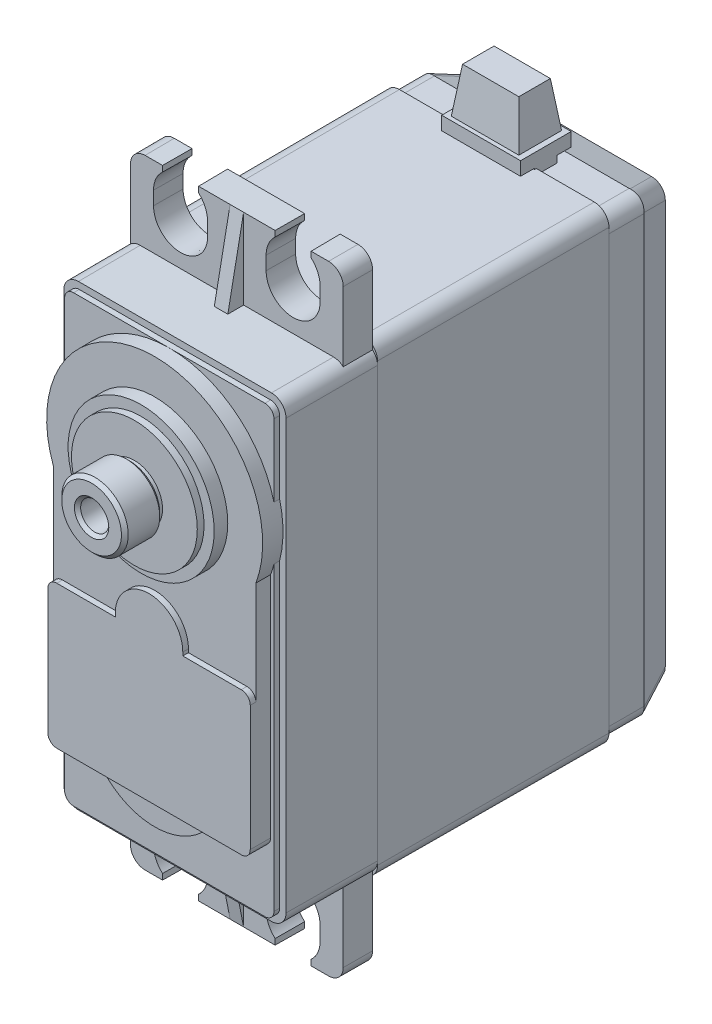
from build123d import *
from OCP.BRepFilletAPI import BRepFilletAPI_MakeChamfer

# Parameters (mm, degrees)
SKETCH1_W                       = 19.8
SKETCH1_H                       = 41.4
BOSS_EXTRUDE1_DEPTH             = 20.5
BOSS_EXTRUDE1_DRAFT             = 0.15
SKETCH2_W                       = 19.9
SKETCH2_H                       = 40.5
BOSS_EXTRUDE2_DEPTH             = 6.1
SKETCH4_W                       = 19.8
SKETCH4_H                       = 55
BOSS_EXTRUDE3_DEPTH             = 2.6
BOSS_EXTRUDE3_TAPER             = 0.2
SKETCH6_W                       = 19.781848502
SKETCH6_H                       = 40.7
BOSS_EXTRUDE4_DEPTH             = 6
BOSS_EXTRUDE4_TAPER             = 0.2
SKETCH19_W                      = 2
SKETCH19_H                      = 9
CUT_EXTRUDE4_DEPTH              = 2.6
CUT_EXTRUDE4_DRAFT              = -0.2
CUT_EXTRUDE4_PROFILE_2_DEPTH    = 2.6
CUT_EXTRUDE4_PROFILE_2_DRAFT    = -0.2
CUT_EXTRUDE4_PROFILE_3_DEPTH    = 2.6
CUT_EXTRUDE4_PROFILE_3_DRAFT    = -0.2
CUT_EXTRUDE4_PROFILE_4_DEPTH    = 2.6
CUT_EXTRUDE4_PROFILE_4_DRAFT    = -0.2
SKETCH8_OUTSIDE_W               = 35.562
SKETCH8_OUTSIDE_H               = 70.654
SKETCH8_OUTSIDE_W_2             = 18.6
SKETCH8_OUTSIDE_H_2             = 39.5
CUT_EXTRUDE1_DEPTH              = 0.5
BOSS_EXTRUDE5_DEPTH             = 1.8
CHAMFER1_SIZE                   = 0.3
DRAFT1_ANGLE                    = 0.2
CUT_EXTRUDE2_DEPTH              = 42.327539565
CUT_EXTRUDE2_DRAFT              = -0.5
CUT_EXTRUDE2_PROFILE_2_DEPTH    = 42.327539565
CUT_EXTRUDE2_PROFILE_2_DRAFT    = -0.5
CUT_EXTRUDE2_PROFILE_3_DEPTH    = 42.327539565
CUT_EXTRUDE2_PROFILE_3_DRAFT    = -0.5
CUT_EXTRUDE2_PROFILE_4_DEPTH    = 42.327539565
CUT_EXTRUDE2_PROFILE_4_DRAFT    = -0.5
BOSS_EXTRUDE6_DEPTH             = 3.5
CUT_EXTRUDE3_DEPTH              = 40.533347019
BOSS_EXTRUDE7_DEPTH             = 0.6
BOSS_EXTRUDE8_DEPTH             = 0.5
BOSS_EXTRUDE8_TAPER             = 0.2
CHAMFER2_SIZE                   = 3
CHAMFER2_SIZE2                  = 1.091910703
FILLET1_R                       = 1.3
FILLET2_R                       = 1.3
FILLET3_R                       = 0.8
M3X0_5_TAPPED_HOLE1_D           = 2.5
M3X0_5_TAPPED_HOLE1_DEPTH       = 6.5
M3X0_5_TAPPED_HOLE1_CSINK_D     = 3.05
M3X0_5_TAPPED_HOLE1_CSINK_ANGLE = 90
M3X0_5_TAPPED_HOLE1_TIP         = 0.751075774


with BuildPart() as part:
    # Sketch1 → Boss-Extrude1 (with draft: the straight prism first)
    with BuildSketch(Plane.XY):
        Rectangle(SKETCH1_W, SKETCH1_H)
    extrude(amount=-BOSS_EXTRUDE1_DEPTH)
    # Boss-Extrude1: the draft: its side faces are tilted about the plane it starts from
    boss_extrude1_sides = [part.faces().sort_by_distance(p)[0] for p in [
        (0, -20.7, -10.25),
        (9.9, 0, -10.25),
        (0, 20.7, -10.25),
        (-9.9, 0, -10.25),
    ]]
    draft(boss_extrude1_sides, Plane.XY, BOSS_EXTRUDE1_DRAFT)

    # Sketch2 → Boss-Extrude2 (add)
    with BuildSketch(Plane(origin=(0, 0, -20.5), x_dir=(-1, 0, 0), z_dir=(0, 0, -1))):
        Rectangle(SKETCH2_W, SKETCH2_H)
    extrude(amount=BOSS_EXTRUDE2_DEPTH)

    # Sketch4 → Boss-Extrude3 (add)
    with BuildSketch(Plane.XY):
        Rectangle(SKETCH4_W, SKETCH4_H)
    extrude(amount=BOSS_EXTRUDE3_DEPTH, taper=BOSS_EXTRUDE3_TAPER)

    # Sketch6 → Boss-Extrude4 (add)
    with BuildSketch(Plane.XY.offset(2.6)):
        Rectangle(SKETCH6_W, SKETCH6_H)
    extrude(amount=BOSS_EXTRUDE4_DEPTH, taper=BOSS_EXTRUDE4_TAPER)


with BuildPart() as cut_extrude4_tool:
    # Sketch19 → Cut-Extrude4 (with draft: the straight prism first)
    with BuildSketch(Plane.XY.offset(2.6)):
        with Locations((-10.45, 24.85)):
            Rectangle(SKETCH19_W, SKETCH19_H)
    extrude(amount=-CUT_EXTRUDE4_DEPTH)
    # Cut-Extrude4: the draft: its side faces are tilted about the plane it starts from
    cut_extrude4_sides = [cut_extrude4_tool.faces().sort_by_distance(p)[0] for p in [
        (-9.45, 24.85, 1.3),
        (-10.45, 29.35, 1.3),
        (-11.45, 24.85, 1.3),
        (-10.45, 20.35, 1.3),
    ]]
    draft(cut_extrude4_sides, Plane.XY.offset(2.6), CUT_EXTRUDE4_DRAFT)


with BuildPart() as part_1:
    add(part.part)

    # Cut-Extrude4: cut by cut_extrude4_tool
    add(cut_extrude4_tool.part, mode=Mode.SUBTRACT)


with BuildPart() as cut_extrude4_profile_2_tool:
    # Sketch19 → Cut-Extrude4 profile 2 (with draft: the straight prism first)
    with BuildSketch(Plane.XY.offset(2.6)):
        with Locations((10.45, 24.85)):
            Rectangle(SKETCH19_W, SKETCH19_H)
    extrude(amount=-CUT_EXTRUDE4_PROFILE_2_DEPTH)
    # Cut-Extrude4 profile 2: the draft: its side faces are tilted about the plane it starts from
    cut_extrude4_profile_2_sides = [cut_extrude4_profile_2_tool.faces().sort_by_distance(p)[0] for p in [
        (11.45, 24.85, 1.3),
        (10.45, 29.35, 1.3),
        (9.45, 24.85, 1.3),
        (10.45, 20.35, 1.3),
    ]]
    draft(cut_extrude4_profile_2_sides, Plane.XY.offset(2.6), CUT_EXTRUDE4_PROFILE_2_DRAFT)


with BuildPart() as part_2:
    add(part_1.part)

    # Cut-Extrude4 profile 2: cut by cut_extrude4_profile_2_tool
    add(cut_extrude4_profile_2_tool.part, mode=Mode.SUBTRACT)


with BuildPart() as cut_extrude4_profile_3_tool:
    # Sketch19 → Cut-Extrude4 profile 3 (with draft: the straight prism first)
    with BuildSketch(Plane.XY.offset(2.6)):
        with Locations((10.45, -24.85)):
            Rectangle(SKETCH19_W, SKETCH19_H)
    extrude(amount=-CUT_EXTRUDE4_PROFILE_3_DEPTH)
    # Cut-Extrude4 profile 3: the draft: its side faces are tilted about the plane it starts from
    cut_extrude4_profile_3_sides = [cut_extrude4_profile_3_tool.faces().sort_by_distance(p)[0] for p in [
        (9.45, -24.85, 1.3),
        (10.45, -29.35, 1.3),
        (11.45, -24.85, 1.3),
        (10.45, -20.35, 1.3),
    ]]
    draft(cut_extrude4_profile_3_sides, Plane.XY.offset(2.6), CUT_EXTRUDE4_PROFILE_3_DRAFT)


with BuildPart() as part_3:
    add(part_2.part)

    # Cut-Extrude4 profile 3: cut by cut_extrude4_profile_3_tool
    add(cut_extrude4_profile_3_tool.part, mode=Mode.SUBTRACT)


with BuildPart() as cut_extrude4_profile_4_tool:
    # Sketch19 → Cut-Extrude4 profile 4 (with draft: the straight prism first)
    with BuildSketch(Plane.XY.offset(2.6)):
        with Locations((-10.45, -24.85)):
            Rectangle(SKETCH19_W, SKETCH19_H)
    extrude(amount=-CUT_EXTRUDE4_PROFILE_4_DEPTH)
    # Cut-Extrude4 profile 4: the draft: its side faces are tilted about the plane it starts from
    cut_extrude4_profile_4_sides = [cut_extrude4_profile_4_tool.faces().sort_by_distance(p)[0] for p in [
        (-11.45, -24.85, 1.3),
        (-10.45, -29.35, 1.3),
        (-9.45, -24.85, 1.3),
        (-10.45, -20.35, 1.3),
    ]]
    draft(cut_extrude4_profile_4_sides, Plane.XY.offset(2.6), CUT_EXTRUDE4_PROFILE_4_DRAFT)


with BuildPart() as part_4:
    add(part_3.part)

    # Cut-Extrude4 profile 4: cut by cut_extrude4_profile_4_tool
    add(cut_extrude4_profile_4_tool.part, mode=Mode.SUBTRACT)

    # Sketch8 outside → Cut-Extrude1 (cut)
    with BuildSketch(Plane.XY.offset(8.6)):
        Rectangle(SKETCH8_OUTSIDE_W, SKETCH8_OUTSIDE_H)
        Rectangle(SKETCH8_OUTSIDE_W_2, SKETCH8_OUTSIDE_H_2, mode=Mode.SUBTRACT)
    extrude(amount=-CUT_EXTRUDE1_DEPTH, mode=Mode.SUBTRACT)

    # Sketch9 → Boss-Extrude5 (add)
    with BuildSketch(Plane.XY.offset(8.1)):
        with BuildLine():
            Line((-9, 6.809341382), (-9, -14.25))
            Line((-9, -14.25), (-4.7, -14.25))
            ThreePointArc((-4.7, -14.25), (0, -16.45), (4.7, -14.25))
            Line((4.7, -14.25), (9, -14.25))
            Line((9, -14.25), (9, 6.809341382))
            ThreePointArc((9, 6.809341382), (0, 19.75), (-9, 6.809341382))
        make_face()
    extrude(amount=BOSS_EXTRUDE5_DEPTH)

    # Sketch11 → Revolve1 (revolve)
    with BuildSketch(Plane(origin=(0, 0, 0), x_dir=(0, 0, -1), z_dir=(1, 0, 0)), mode=Mode.PRIVATE) as revolve1_sk:
        Polygon((-9.9, 16.65), (-9.9, 10.15), (-11.7, 10.15), (-11.7, 15.75), (-11.1, 15.75), (-11.1, 16.65), align=None)
    revolve(revolve1_sk.sketch.rotate(Axis((0, 10.15, 7.981204221), (0, 0, 1)), 90), axis=Axis((0, 10.15, 7.981204221), (0, 0, 1)))

    # Sketch13 → Revolve2 (revolve)
    with BuildSketch(Plane(origin=(0, 0, 0), x_dir=(0, 0, -1), z_dir=(1, 0, 0))):
        Polygon((-11.7, 12.65), (-11.7, 10.15), (-15.5, 10.15), (-15.5, 13.1), (-12.1, 13.1), (-12.1, 12.65), align=None)
    revolve(axis=Axis((0, 10.15, 10.310113646), (0, 0, 1)))

    # Chamfer1
    chamfer1_edges = [part_4.edges().sort_by_distance(p)[0] for p in [
        (0, 7.2, 15.5),
        (0, 7.2, 12.1),
    ]]
    chamfer(chamfer1_edges, length=CHAMFER1_SIZE)

    # Draft1
    draft1_faces = [part_4.faces().sort_by_distance(p)[0] for p in [
        (0, -19.75, 8.35),
        (-6.85, -14.25, 9.25),
        (0, -16.45, 9.25),
        (6.85, -14.25, 9.25),
        (9, -3.720329309, 9.25),
        (9.3, -5.99058809, 8.35),
        (9.3, 16.14058809, 8.35),
        (5.6, 10.15, 11.4),
        (6.5, 10.15, 10.5),
        (-9.3, -5.99058809, 8.35),
        (-9, -3.720329309, 9.25),
        (0, 19.75, 8.35),
        (0, 19.75, 9),
        (-9.3, 16.14058809, 8.35),
    ]]
    draft(draft1_faces, Plane.XY.offset(8.1), DRAFT1_ANGLE)


with BuildPart() as cut_extrude2_tool:
    # Sketch15 → Cut-Extrude2 (with draft: the straight prism first)
    with BuildSketch(Plane.XY.offset(2.6)):
        with BuildLine():
            Line((2.6, 25.190924251), (2.6, 23.990924251))
            ThreePointArc((2.6, 23.990924251), (5, 21.590924251), (7.4, 23.990924251))
            Line((7.4, 23.990924251), (7.4, 25.190924251))
            ThreePointArc((7.4, 25.190924251), (7.19089023, 26.170720148), (6.6, 26.979778633))
            Line((6.6, 26.979778633), (6.6, 28))
            Line((6.6, 28), (3.4, 28))
            Line((3.4, 28), (3.4, 26.979778633))
            ThreePointArc((3.4, 26.979778633), (2.80910977, 26.170720148), (2.6, 25.190924251))
        make_face()
    extrude(amount=-CUT_EXTRUDE2_DEPTH)
    # Cut-Extrude2: the draft: its side faces are tilted about the plane it starts from
    cut_extrude2_sides = [cut_extrude2_tool.faces().sort_by_distance(p)[0] for p in [
        (2.6, 24.590924251, -18.563769783),
        (5, 21.590924251, -18.563769783),
        (7.4, 24.590924251, -18.563769783),
        (7.19089023, 26.170720148, -18.563769783),
        (6.6, 27.489889317, -18.563769783),
        (5, 28, -18.563769783),
        (3.4, 27.489889317, -18.563769783),
        (2.80910977, 26.170720148, -18.563769783),
    ]]
    draft(cut_extrude2_sides, Plane.XY.offset(2.6), CUT_EXTRUDE2_DRAFT)


with BuildPart() as part_5:
    add(part_4.part)

    # Cut-Extrude2: cut by cut_extrude2_tool
    add(cut_extrude2_tool.part, mode=Mode.SUBTRACT)


with BuildPart() as cut_extrude2_profile_2_tool:
    # Sketch15 → Cut-Extrude2 profile 2 (with draft: the straight prism first)
    with BuildSketch(Plane.XY.offset(2.6)):
        with BuildLine():
            ThreePointArc((-6.6, 26.979778633), (-7.19089023, 26.170720148), (-7.4, 25.190924251))
            Line((-7.4, 25.190924251), (-7.4, 23.990924251))
            ThreePointArc((-7.4, 23.990924251), (-5, 21.590924251), (-2.6, 23.990924251))
            Line((-2.6, 23.990924251), (-2.6, 25.190924251))
            ThreePointArc((-2.6, 25.190924251), (-2.80910977, 26.170720148), (-3.4, 26.979778633))
            Line((-3.4, 26.979778633), (-3.4, 28))
            Line((-3.4, 28), (-6.6, 28))
            Line((-6.6, 28), (-6.6, 26.979778633))
        make_face()
    extrude(amount=-CUT_EXTRUDE2_PROFILE_2_DEPTH)
    # Cut-Extrude2 profile 2: the draft: its side faces are tilted about the plane it starts from
    cut_extrude2_profile_2_sides = [cut_extrude2_profile_2_tool.faces().sort_by_distance(p)[0] for p in [
        (-7.19089023, 26.170720148, -18.563769783),
        (-7.4, 24.590924251, -18.563769783),
        (-5, 21.590924251, -18.563769783),
        (-2.6, 24.590924251, -18.563769783),
        (-2.80910977, 26.170720148, -18.563769783),
        (-3.4, 27.489889317, -18.563769783),
        (-5, 28, -18.563769783),
        (-6.6, 27.489889317, -18.563769783),
    ]]
    draft(cut_extrude2_profile_2_sides, Plane.XY.offset(2.6), CUT_EXTRUDE2_PROFILE_2_DRAFT)


with BuildPart() as part_6:
    add(part_5.part)

    # Cut-Extrude2 profile 2: cut by cut_extrude2_profile_2_tool
    add(cut_extrude2_profile_2_tool.part, mode=Mode.SUBTRACT)


with BuildPart() as cut_extrude2_profile_3_tool:
    # Sketch15 → Cut-Extrude2 profile 3 (with draft: the straight prism first)
    with BuildSketch(Plane.XY.offset(2.6)):
        with BuildLine():
            Line((-2.6, -25.190924251), (-2.6, -23.990924251))
            ThreePointArc((-2.6, -23.990924251), (-5, -21.590924251), (-7.4, -23.990924251))
            Line((-7.4, -23.990924251), (-7.4, -25.190924251))
            ThreePointArc((-7.4, -25.190924251), (-7.19089023, -26.170720148), (-6.6, -26.979778633))
            Line((-6.6, -26.979778633), (-6.6, -28))
            Line((-6.6, -28), (-3.4, -28))
            Line((-3.4, -28), (-3.4, -26.979778633))
            ThreePointArc((-3.4, -26.979778633), (-2.80910977, -26.170720148), (-2.6, -25.190924251))
        make_face()
    extrude(amount=-CUT_EXTRUDE2_PROFILE_3_DEPTH)
    # Cut-Extrude2 profile 3: the draft: its side faces are tilted about the plane it starts from
    cut_extrude2_profile_3_sides = [cut_extrude2_profile_3_tool.faces().sort_by_distance(p)[0] for p in [
        (-2.6, -24.590924251, -18.563769783),
        (-5, -21.590924251, -18.563769783),
        (-7.4, -24.590924251, -18.563769783),
        (-7.19089023, -26.170720148, -18.563769783),
        (-6.6, -27.489889317, -18.563769783),
        (-5, -28, -18.563769783),
        (-3.4, -27.489889317, -18.563769783),
        (-2.80910977, -26.170720148, -18.563769783),
    ]]
    draft(cut_extrude2_profile_3_sides, Plane.XY.offset(2.6), CUT_EXTRUDE2_PROFILE_3_DRAFT)


with BuildPart() as part_7:
    add(part_6.part)

    # Cut-Extrude2 profile 3: cut by cut_extrude2_profile_3_tool
    add(cut_extrude2_profile_3_tool.part, mode=Mode.SUBTRACT)


with BuildPart() as cut_extrude2_profile_4_tool:
    # Sketch15 → Cut-Extrude2 profile 4 (with draft: the straight prism first)
    with BuildSketch(Plane.XY.offset(2.6)):
        with BuildLine():
            ThreePointArc((6.6, -26.979778633), (7.19089023, -26.170720148), (7.4, -25.190924251))
            Line((7.4, -25.190924251), (7.4, -23.990924251))
            ThreePointArc((7.4, -23.990924251), (5, -21.590924251), (2.6, -23.990924251))
            Line((2.6, -23.990924251), (2.6, -25.190924251))
            ThreePointArc((2.6, -25.190924251), (2.80910977, -26.170720148), (3.4, -26.979778633))
            Line((3.4, -26.979778633), (3.4, -28))
            Line((3.4, -28), (6.6, -28))
            Line((6.6, -28), (6.6, -26.979778633))
        make_face()
    extrude(amount=-CUT_EXTRUDE2_PROFILE_4_DEPTH)
    # Cut-Extrude2 profile 4: the draft: its side faces are tilted about the plane it starts from
    cut_extrude2_profile_4_sides = [cut_extrude2_profile_4_tool.faces().sort_by_distance(p)[0] for p in [
        (7.19089023, -26.170720148, -18.563769783),
        (7.4, -24.590924251, -18.563769783),
        (5, -21.590924251, -18.563769783),
        (2.6, -24.590924251, -18.563769783),
        (2.80910977, -26.170720148, -18.563769783),
        (3.4, -27.489889317, -18.563769783),
        (5, -28, -18.563769783),
        (6.6, -27.489889317, -18.563769783),
    ]]
    draft(cut_extrude2_profile_4_sides, Plane.XY.offset(2.6), CUT_EXTRUDE2_PROFILE_4_DRAFT)


with BuildPart() as part_8:
    add(part_7.part)

    # Cut-Extrude2 profile 4: cut by cut_extrude2_profile_4_tool
    add(cut_extrude2_profile_4_tool.part, mode=Mode.SUBTRACT)

    # Sketch16 → Boss-Extrude6 (add, symmetric)
    with BuildSketch(Plane(origin=(0, 0, 0), x_dir=(0, 0, -1), z_dir=(1, 0, 0))):
        Polygon((22.35, 20.853668997), (23.6, 20.853668997), (23.6, 22.053668997), (23.25, 22.053668997), (22.75, 26.053668997), (19.95, 26.053668997), (19.45, 22.053668997), (19.1, 22.053668997), (19.1, 20.853668997), (20.35, 20.853668997), (20.35, 18.853668997), (22.35, 18.853668997), align=None)
    extrude(amount=BOSS_EXTRUDE6_DEPTH, both=True)

    # Sketch17 → Cut-Extrude3 (cut, through all)
    with BuildSketch(Plane.XY):
        Polygon((3, 22.053668997), (2.5, 26.053668997), (-2.5, 26.053668997), (-3, 22.053668997), (-3.5, 22.053668997), (-3.5, 28.053668997), (3.5, 28.053668997), (3.5, 22.053668997), align=None)
    extrude(amount=-CUT_EXTRUDE3_DEPTH, mode=Mode.SUBTRACT)

    # Sketch18 → Boss-Extrude7 (add, symmetric)
    with BuildSketch(Plane(origin=(0, 0, 0), x_dir=(0, 0, -1), z_dir=(1, 0, 0))):
        Polygon((-2.6, 27.490924251), (-2.6, 20.345113058), (-4, 20.345113058), align=None)
    boss_extrude7 = extrude(amount=BOSS_EXTRUDE7_DEPTH, both=True)

    # Mirror1: Boss-Extrude7 across plane
    add(boss_extrude7.mirror(Plane.ZX))

    # Sketch20 → Boss-Extrude8 (add)
    with BuildSketch(Plane.XY.offset(9.9)):
        with BuildLine():
            Line((8.993716789, -14.243716789), (8.993716789, -1.543716789))
            Line((8.993716789, -1.543716789), (3, -1.543716789))
            Line((3, -1.543716789), (3, -1.243716789))
            ThreePointArc((3, -1.243716789), (0, 1.756283211), (-3, -1.243716789))
            Line((-3, -1.243716789), (-3, -1.543716789))
            Line((-3, -1.543716789), (-8.993716789, -1.543716789))
            Line((-8.993716789, -1.543716789), (-8.993716789, -14.243716789))
            Line((-8.993716789, -14.243716789), (8.993716789, -14.243716789))
        make_face()
    extrude(amount=BOSS_EXTRUDE8_DEPTH, taper=BOSS_EXTRUDE8_TAPER)

    # Chamfer2: one chamfer whose edges measure the first distance from different faces: ONE call of the kernel's chamfer builder (chamfer() names one face for all edges)
    chamfer2_edges_1 = [part_8.edges().sort_by_distance(p)[0] for p in [
        (-9.95, 0, -26.6),
    ]]
    chamfer2_side_1 = [part_8.faces().sort_by_distance(p)[0] for p in [
        (-9.95, 0, -23.55),
    ]]
    chamfer2_edges_2 = [part_8.edges().sort_by_distance(p)[0] for p in [
        (0, 20.25, -26.6),
    ]]
    chamfer2_side_2 = [part_8.faces().sort_by_distance(p)[0] for p in [
        (0, 20.25, -23.803769366),
    ]]
    chamfer2_edges_3 = [part_8.edges().sort_by_distance(p)[0] for p in [
        (9.95, 0, -26.6),
    ]]
    chamfer2_side_3 = [part_8.faces().sort_by_distance(p)[0] for p in [
        (9.95, 0, -23.55),
    ]]
    chamfer2_edges_4 = [part_8.edges().sort_by_distance(p)[0] for p in [
        (0, -20.25, -26.6),
    ]]
    chamfer2_side_4 = [part_8.faces().sort_by_distance(p)[0] for p in [
        (0, -20.25, -23.55),
    ]]
    chamfer2 = BRepFilletAPI_MakeChamfer(part_8.part.solid().wrapped)
    for e in chamfer2_edges_1:
        chamfer2.Add(CHAMFER2_SIZE, CHAMFER2_SIZE2, e.wrapped, chamfer2_side_1[0].wrapped)  # the first distance lies on this face
    for e in chamfer2_edges_2:
        chamfer2.Add(CHAMFER2_SIZE, CHAMFER2_SIZE2, e.wrapped, chamfer2_side_2[0].wrapped)  # the first distance lies on this face
    for e in chamfer2_edges_3:
        chamfer2.Add(CHAMFER2_SIZE, CHAMFER2_SIZE2, e.wrapped, chamfer2_side_3[0].wrapped)  # the first distance lies on this face
    for e in chamfer2_edges_4:
        chamfer2.Add(CHAMFER2_SIZE, CHAMFER2_SIZE2, e.wrapped, chamfer2_side_4[0].wrapped)  # the first distance lies on this face
    add(Compound.cast(chamfer2.Shape()), mode=Mode.REPLACE)

    # Fillet1
    # the kernel refuses this fillet: 1.3 mm, written as the material it takes off along each edge
    with BuildSketch(Plane(origin=(9.470420159, -27.51134441, -3.249920801), x_dir=(1.2184573071548758e-05, 0.9999939077320228, -0.0034906088831265034), z_dir=(-0.0034906301492399006, 0.0034906301492399036, 0.9999878154269294)), Plane(origin=(-9.43865559, -27.479579841, 5.849920801), x_dir=(-1.2184573071546372e-05, 0.9999939077320228, -0.003490608883126504), z_dir=(-0.0034906301492399006, -0.0034906301492399036, -0.9999878154269294)), Plane(origin=(-9.470420159, 27.51134441, -3.249920801), x_dir=(-1.2184573071548758e-05, -0.9999939077320228, -0.0034906088831265034), z_dir=(0.0034906301492399006, -0.0034906301492399036, 0.9999878154269294)), Plane(origin=(9.43865559, 27.479579841, 5.849920801), x_dir=(1.2184573071546372e-05, -0.9999939077320228, -0.003490608883126504), z_dir=(0.0034906301492399006, 0.0034906301492399036, -0.9999878154269294))) as fillet1_piece_1:
        with BuildLine():
            CenterArc((FILLET1_R * 0.999987815427, FILLET1_R), FILLET1_R, 180.000698129, 89.999301871)
            Line((-FILLET1_R * 1.21844988387e-05, FILLET1_R * 0.999987815353), (0, 0))
            Line((0, 0), (FILLET1_R * 0.999987815427, 0))
        make_face()
    extrude(amount=9.099952481, mode=Mode.SUBTRACT)
    with BuildSketch(Plane(origin=(-9.91134441, -20.370420159, -3.249920801), x_dir=(-1.218457307154672e-05, 0.9999939077320228, -0.0034906088831266027), z_dir=(0.003490630149240003, 0.003490630149240003, 0.9999878154269294))) as fillet1_piece_2_section:
        with BuildLine():
            CenterArc((FILLET1_R * 0.999987815427, -FILLET1_R), FILLET1_R, 90, 89.999301871)
            Line((-FILLET1_R * 1.21844988414e-05, -FILLET1_R * 0.999987815353), (0, 0))
            Line((0, 0), (FILLET1_R * 0.999987815427, 0))
        make_face()
    fillet1_piece_2 = extrude(amount=14.600019497, mode=Mode.PRIVATE)
    fillet1_piece_2 = split(fillet1_piece_2, bisect_by=Plane(origin=(-9.738404308, -19.984332655, 0), z_dir=(0, 0, 1)), keep=Keep.TOP, mode=Mode.PRIVATE)
    fillet1_piece_2 = split(fillet1_piece_2, bisect_by=Plane(origin=(-9.454541333, -19.984332655, 1.299009127), z_dir=(-0.9999939076577904, 0, 0.003490651415223737)), keep=Keep.TOP, mode=Mode.PRIVATE)
    fillet1_piece_2 = split(fillet1_piece_2, bisect_by=Plane(origin=(-9.738404308, -19.984332655, 2.6), z_dir=(0, 0, -1)), keep=Keep.TOP, mode=Mode.PRIVATE)
    add(fillet1_piece_2, mode=Mode.SUBTRACT)
    with BuildSketch(Plane(origin=(-9.91134441, -20.370420159, -3.249920801), x_dir=(-1.218457307154672e-05, 0.9999939077320228, -0.0034906088831266027), z_dir=(0.003490630149240003, 0.003490630149240003, 0.9999878154269294))) as fillet1_piece_3_section:
        with BuildLine():
            CenterArc((FILLET1_R * 0.999987815427, -FILLET1_R), FILLET1_R, 90, 89.999301871)
            Line((-FILLET1_R * 1.21844988414e-05, -FILLET1_R * 0.999987815353), (0, 0))
            Line((0, 0), (FILLET1_R * 0.999987815427, 0))
        make_face()
    fillet1_piece_3 = extrude(amount=14.600019497, mode=Mode.PRIVATE)
    fillet1_piece_3 = split(fillet1_piece_3, bisect_by=Plane(origin=(-9.434735116, -19.964551365, 6.973049343), z_dir=(-0.9999939076577904, 0, 0.003490651415223737)), keep=Keep.TOP, mode=Mode.PRIVATE)
    fillet1_piece_3 = split(fillet1_piece_3, bisect_by=Plane(origin=(-9.718597691, -19.964551365, 2.6), z_dir=(0, 0, 1)), keep=Keep.TOP, mode=Mode.PRIVATE)
    add(fillet1_piece_3, mode=Mode.SUBTRACT)
    with BuildSketch(Plane(origin=(-9.91134441, -20.370420159, -3.249920801), x_dir=(-1.218457307154672e-05, 0.9999939077320228, -0.0034906088831266027), z_dir=(0.003490630149240003, 0.003490630149240003, 0.9999878154269294))) as fillet1_piece_4_section:
        with BuildLine():
            CenterArc((FILLET1_R * 0.999987815427, -FILLET1_R), FILLET1_R, 90, 89.999301871)
            Line((-FILLET1_R * 1.21844988414e-05, -FILLET1_R * 0.999987815353), (0, 0))
            Line((0, 0), (FILLET1_R * 0.999987815427, 0))
        make_face()
    fillet1_piece_4 = extrude(amount=14.600019497, mode=Mode.PRIVATE)
    fillet1_piece_4 = split(fillet1_piece_4, bisect_by=Plane(origin=(-9.434730029, -20.261831475, 6.974506581), z_dir=(0.9999939076577904, 0, -0.003490651415223737)), keep=Keep.TOP, mode=Mode.PRIVATE)
    fillet1_piece_4 = split(fillet1_piece_4, bisect_by=Plane(origin=(-9.180937819, -20.261831475, 2.6), z_dir=(0, 0, 1)), keep=Keep.TOP, mode=Mode.PRIVATE)
    add(fillet1_piece_4, mode=Mode.SUBTRACT)
    with BuildSketch(Plane(origin=(9.860381142, -20.31945689, 11.349920801), x_dir=(1.2184573071541947e-05, 0.9999939077320228, -0.0034906088831266027), z_dir=(0.0034906301492404162, -0.003490630149240003, -0.9999878154269294))) as fillet1_piece_5_section:
        with BuildLine():
            CenterArc((FILLET1_R * 0.999987815427, -FILLET1_R), FILLET1_R, 90, 89.999301871)
            Line((-FILLET1_R * 1.21844988387e-05, -FILLET1_R * 0.999987815353), (0, 0))
            Line((0, 0), (FILLET1_R * 0.999987815427, 0))
        make_face()
    fillet1_piece_5 = extrude(amount=14.600019497, mode=Mode.PRIVATE)
    fillet1_piece_5 = split(fillet1_piece_5, bisect_by=Plane(origin=(9.434735116, -19.964551365, 6.973049343), z_dir=(0.9999939076577904, 0, 0.003490651415223737)), keep=Keep.TOP, mode=Mode.PRIVATE)
    fillet1_piece_5 = split(fillet1_piece_5, bisect_by=Plane(origin=(9.718597691, -19.964551365, 2.6), z_dir=(0, 0, 1)), keep=Keep.TOP, mode=Mode.PRIVATE)
    add(fillet1_piece_5, mode=Mode.SUBTRACT)
    with BuildSketch(Plane(origin=(9.860381142, -20.31945689, 11.349920801), x_dir=(1.2184573071541947e-05, 0.9999939077320228, -0.0034906088831266027), z_dir=(0.0034906301492404162, -0.003490630149240003, -0.9999878154269294))) as fillet1_piece_6_section:
        with BuildLine():
            CenterArc((FILLET1_R * 0.999987815427, -FILLET1_R), FILLET1_R, 90, 89.999301871)
            Line((-FILLET1_R * 1.21844988387e-05, -FILLET1_R * 0.999987815353), (0, 0))
            Line((0, 0), (FILLET1_R * 0.999987815427, 0))
        make_face()
    fillet1_piece_6 = extrude(amount=14.600019497, mode=Mode.PRIVATE)
    fillet1_piece_6 = split(fillet1_piece_6, bisect_by=Plane(origin=(9.434730029, -20.261831475, 6.974506581), z_dir=(-0.9999939076577904, 0, -0.003490651415223737)), keep=Keep.TOP, mode=Mode.PRIVATE)
    fillet1_piece_6 = split(fillet1_piece_6, bisect_by=Plane(origin=(9.180937819, -20.261831475, 2.6), z_dir=(0, 0, 1)), keep=Keep.TOP, mode=Mode.PRIVATE)
    add(fillet1_piece_6, mode=Mode.SUBTRACT)
    with BuildSketch(Plane(origin=(9.860381142, -20.31945689, 11.349920801), x_dir=(1.2184573071541947e-05, 0.9999939077320228, -0.0034906088831266027), z_dir=(0.0034906301492404162, -0.003490630149240003, -0.9999878154269294))) as fillet1_piece_7_section:
        with BuildLine():
            CenterArc((FILLET1_R * 0.999987815427, -FILLET1_R), FILLET1_R, 90, 89.999301871)
            Line((-FILLET1_R * 1.21844988387e-05, -FILLET1_R * 0.999987815353), (0, 0))
            Line((0, 0), (FILLET1_R * 0.999987815427, 0))
        make_face()
    fillet1_piece_7 = extrude(amount=14.600019497, mode=Mode.PRIVATE)
    fillet1_piece_7 = split(fillet1_piece_7, bisect_by=Plane(origin=(9.738404308, -19.984332655, 0), z_dir=(0, 0, 1)), keep=Keep.TOP, mode=Mode.PRIVATE)
    fillet1_piece_7 = split(fillet1_piece_7, bisect_by=Plane(origin=(9.454541333, -19.984332655, 1.299009127), z_dir=(0.9999939076577904, 0, 0.003490651415223737)), keep=Keep.TOP, mode=Mode.PRIVATE)
    fillet1_piece_7 = split(fillet1_piece_7, bisect_by=Plane(origin=(9.738404308, -19.984332655, 2.6), z_dir=(0, 0, -1)), keep=Keep.TOP, mode=Mode.PRIVATE)
    add(fillet1_piece_7, mode=Mode.SUBTRACT)
    with BuildSketch(Plane(origin=(9.91134441, 20.370420159, -3.249920801), x_dir=(1.2184573072913148e-05, -0.9999939077320228, -0.0034906088831265984), z_dir=(-0.0034906301492404162, -0.003490630149240003, 0.9999878154269294))) as fillet1_piece_8_section:
        with BuildLine():
            CenterArc((FILLET1_R * 0.999987815427, -FILLET1_R), FILLET1_R, 90, 89.999301871)
            Line((-FILLET1_R * 1.21844988428e-05, -FILLET1_R * 0.999987815353), (0, 0))
            Line((0, 0), (FILLET1_R * 0.999987815427, 0))
        make_face()
    fillet1_piece_8 = extrude(amount=14.600019497, mode=Mode.PRIVATE)
    fillet1_piece_8 = split(fillet1_piece_8, bisect_by=Plane(origin=(9.738404308, 19.984332655, 0), z_dir=(0, 0, 1)), keep=Keep.TOP, mode=Mode.PRIVATE)
    fillet1_piece_8 = split(fillet1_piece_8, bisect_by=Plane(origin=(9.454541333, 19.984332655, 1.299009127), z_dir=(0.9999939076577904, 0, 0.003490651415223737)), keep=Keep.TOP, mode=Mode.PRIVATE)
    fillet1_piece_8 = split(fillet1_piece_8, bisect_by=Plane(origin=(9.738404308, 19.984332655, 2.6), z_dir=(0, 0, -1)), keep=Keep.TOP, mode=Mode.PRIVATE)
    add(fillet1_piece_8, mode=Mode.SUBTRACT)
    with BuildSketch(Plane(origin=(9.91134441, 20.370420159, -3.249920801), x_dir=(1.2184573072913148e-05, -0.9999939077320228, -0.0034906088831265984), z_dir=(-0.0034906301492404162, -0.003490630149240003, 0.9999878154269294))) as fillet1_piece_9_section:
        with BuildLine():
            CenterArc((FILLET1_R * 0.999987815427, -FILLET1_R), FILLET1_R, 90, 89.999301871)
            Line((-FILLET1_R * 1.21844988428e-05, -FILLET1_R * 0.999987815353), (0, 0))
            Line((0, 0), (FILLET1_R * 0.999987815427, 0))
        make_face()
    fillet1_piece_9 = extrude(amount=14.600019497, mode=Mode.PRIVATE)
    fillet1_piece_9 = split(fillet1_piece_9, bisect_by=Plane(origin=(9.434735116, 19.964551365, 6.973049343), z_dir=(0.9999939076577904, 0, 0.003490651415223737)), keep=Keep.TOP, mode=Mode.PRIVATE)
    fillet1_piece_9 = split(fillet1_piece_9, bisect_by=Plane(origin=(9.718597691, 19.964551365, 2.6), z_dir=(0, 0, 1)), keep=Keep.TOP, mode=Mode.PRIVATE)
    add(fillet1_piece_9, mode=Mode.SUBTRACT)
    with BuildSketch(Plane(origin=(9.91134441, 20.370420159, -3.249920801), x_dir=(1.2184573072913148e-05, -0.9999939077320228, -0.0034906088831265984), z_dir=(-0.0034906301492404162, -0.003490630149240003, 0.9999878154269294))) as fillet1_piece_10_section:
        with BuildLine():
            CenterArc((FILLET1_R * 0.999987815427, -FILLET1_R), FILLET1_R, 90, 89.999301871)
            Line((-FILLET1_R * 1.21844988428e-05, -FILLET1_R * 0.999987815353), (0, 0))
            Line((0, 0), (FILLET1_R * 0.999987815427, 0))
        make_face()
    fillet1_piece_10 = extrude(amount=14.600019497, mode=Mode.PRIVATE)
    fillet1_piece_10 = split(fillet1_piece_10, bisect_by=Plane(origin=(9.434730029, 20.261831475, 6.974506581), z_dir=(-0.9999939076577904, 0, -0.003490651415223737)), keep=Keep.TOP, mode=Mode.PRIVATE)
    fillet1_piece_10 = split(fillet1_piece_10, bisect_by=Plane(origin=(9.180937819, 20.261831475, 2.6), z_dir=(0, 0, 1)), keep=Keep.TOP, mode=Mode.PRIVATE)
    add(fillet1_piece_10, mode=Mode.SUBTRACT)
    with BuildSketch(Plane(origin=(-9.91134441, 20.370420159, -3.249920801), x_dir=(-1.2184573071546718e-05, -0.9999939077320228, -0.0034906088831266027), z_dir=(0.003490630149240003, -0.003490630149240003, 0.9999878154269294))) as fillet1_piece_11_section:
        with BuildLine():
            CenterArc((FILLET1_R * 0.999987815427, FILLET1_R), FILLET1_R, 180.000698129, 89.999301871)
            Line((-FILLET1_R * 1.21844988387e-05, FILLET1_R * 0.999987815353), (0, 0))
            Line((0, 0), (FILLET1_R * 0.999987815427, 0))
        make_face()
    fillet1_piece_11 = extrude(amount=14.600019497, mode=Mode.PRIVATE)
    fillet1_piece_11 = split(fillet1_piece_11, bisect_by=Plane(origin=(-9.738404308, 19.984332655, 0), z_dir=(0, 0, 1)), keep=Keep.TOP, mode=Mode.PRIVATE)
    fillet1_piece_11 = split(fillet1_piece_11, bisect_by=Plane(origin=(-9.738404308, 19.984332655, 2.6), z_dir=(0, 0, -1)), keep=Keep.TOP, mode=Mode.PRIVATE)
    fillet1_piece_11 = split(fillet1_piece_11, bisect_by=Plane(origin=(-9.454541333, 19.984332655, 1.299009127), z_dir=(-0.9999939076577904, 0, 0.003490651415223737)), keep=Keep.TOP, mode=Mode.PRIVATE)
    add(fillet1_piece_11, mode=Mode.SUBTRACT)
    with BuildSketch(Plane(origin=(-9.91134441, 20.370420159, -3.249920801), x_dir=(-1.2184573071546718e-05, -0.9999939077320228, -0.0034906088831266027), z_dir=(0.003490630149240003, -0.003490630149240003, 0.9999878154269294))) as fillet1_piece_12_section:
        with BuildLine():
            CenterArc((FILLET1_R * 0.999987815427, FILLET1_R), FILLET1_R, 180.000698129, 89.999301871)
            Line((-FILLET1_R * 1.21844988387e-05, FILLET1_R * 0.999987815353), (0, 0))
            Line((0, 0), (FILLET1_R * 0.999987815427, 0))
        make_face()
    fillet1_piece_12 = extrude(amount=14.600019497, mode=Mode.PRIVATE)
    fillet1_piece_12 = split(fillet1_piece_12, bisect_by=Plane(origin=(-9.718597691, 19.964551365, 2.6), z_dir=(0, 0, 1)), keep=Keep.TOP, mode=Mode.PRIVATE)
    fillet1_piece_12 = split(fillet1_piece_12, bisect_by=Plane(origin=(-9.434735116, 19.964551365, 6.973049343), z_dir=(-0.9999939076577904, 0, 0.003490651415223737)), keep=Keep.TOP, mode=Mode.PRIVATE)
    add(fillet1_piece_12, mode=Mode.SUBTRACT)
    with BuildSketch(Plane(origin=(-9.91134441, 20.370420159, -3.249920801), x_dir=(-1.2184573071546718e-05, -0.9999939077320228, -0.0034906088831266027), z_dir=(0.003490630149240003, -0.003490630149240003, 0.9999878154269294))) as fillet1_piece_13_section:
        with BuildLine():
            CenterArc((FILLET1_R * 0.999987815427, FILLET1_R), FILLET1_R, 180.000698129, 89.999301871)
            Line((-FILLET1_R * 1.21844988387e-05, FILLET1_R * 0.999987815353), (0, 0))
            Line((0, 0), (FILLET1_R * 0.999987815427, 0))
        make_face()
    fillet1_piece_13 = extrude(amount=14.600019497, mode=Mode.PRIVATE)
    fillet1_piece_13 = split(fillet1_piece_13, bisect_by=Plane(origin=(-9.180937819, 20.261831475, 2.6), z_dir=(0, 0, 1)), keep=Keep.TOP, mode=Mode.PRIVATE)
    fillet1_piece_13 = split(fillet1_piece_13, bisect_by=Plane(origin=(-9.434730029, 20.261831475, 6.974506581), z_dir=(0.9999939076577904, 0, -0.003490651415223737)), keep=Keep.TOP, mode=Mode.PRIVATE)
    add(fillet1_piece_13, mode=Mode.SUBTRACT)
    with BuildSketch(Plane(origin=(-9.95, -20.25, -20.5), x_dir=(1, 0, 0), z_dir=(0, 0, -1)), Plane(origin=(9.95, -20.25, -20.5), x_dir=(0, 1, 0), z_dir=(0, 0, -1))) as fillet1_piece_14:
        with BuildLine():
            CenterArc((FILLET1_R, -FILLET1_R), FILLET1_R, 90, 90)
            Line((0, -FILLET1_R), (0, 0))
            Line((0, 0), (FILLET1_R, 0))
        make_face()
    extrude(amount=6.35, mode=Mode.SUBTRACT)
    with BuildSketch(Plane(origin=(-9.95, 20.25, -20.5), x_dir=(1, 0, 0), z_dir=(0, 0, -1)), Plane(origin=(9.95, 20.25, -20.5), x_dir=(0, -1, 0), z_dir=(0, 0, -1))) as fillet1_piece_15:
        with BuildLine():
            CenterArc((FILLET1_R, FILLET1_R), FILLET1_R, 180, 90)
            Line((0, FILLET1_R), (0, 0))
            Line((0, 0), (FILLET1_R, 0))
        make_face()
    extrude(amount=6.35, mode=Mode.SUBTRACT)
    with BuildSketch(Plane(origin=(10.885139343, 21.185139343, -21.030725771), x_dir=(0.11068304606838193, -0.9461886483394649, 0.3040991697893316), z_dir=(-0.3236155771181851, -0.3236155771181855, -0.8891264907159879)), Plane(origin=(-10.885139343, 21.185139343, -21.030725771), x_dir=(0.9461886483394651, 0.11068304606838178, 0.3040991697893311), z_dir=(0.323615577118185, -0.3236155771181855, -0.8891264907159879))) as fillet1_piece_16:
        with BuildLine():
            CenterArc((FILLET1_R * 0.889126490716, FILLET1_R), FILLET1_R, 186.717713464, 83.282286536)
            Line((-FILLET1_R * 0.104008041637, FILLET1_R * 0.883022221559), (0, 0))
            Line((0, 0), (FILLET1_R * 0.889126490716, 0))
        make_face()
    extrude(amount=9.153420286, mode=Mode.SUBTRACT)
    with BuildSketch(Plane(origin=(10.885139343, -21.185139343, -21.030725771), x_dir=(0.11068304606838293, 0.9461886483394649, 0.3040991697893312), z_dir=(-0.323615577118185, 0.3236155771181855, -0.8891264907159879)), Plane(origin=(-10.885139343, -21.185139343, -21.030725771), x_dir=(0.9461886483394649, -0.11068304606838177, 0.30409916978933116), z_dir=(0.3236155771181851, 0.3236155771181855, -0.8891264907159879))) as fillet1_piece_17:
        with BuildLine():
            CenterArc((FILLET1_R * 0.889126490716, -FILLET1_R), FILLET1_R, 90, 83.282286536)
            Line((-FILLET1_R * 0.104008041637, -FILLET1_R * 0.883022221559), (0, 0))
            Line((0, 0), (FILLET1_R * 0.889126490716, 0))
        make_face()
    extrude(amount=9.153420286, mode=Mode.SUBTRACT)

    # Fillet2
    # the kernel refuses this fillet: 1.3 mm, written as the material it takes off along each edge
    with BuildSketch(Plane(origin=(9.891491617, 20.691491617, 3.24995545), x_dir=(6.853852797668276e-06, -0.9999965730794724, -0.0026179729440936627), z_dir=(0.002617981915771118, 0.002617981915771118, -0.9999931461472011))) as fillet2_piece_1_section:
        with BuildLine():
            CenterArc((FILLET2_R * 0.999993146147, FILLET2_R), FILLET2_R, 180.000392698, 89.999607302)
            Line((-FILLET2_R * 6.85382930729e-06, FILLET2_R * 0.999993146124), (0, 0))
            Line((0, 0), (FILLET2_R * 0.999993146147, 0))
        make_face()
    fillet2_piece_1 = extrude(amount=27.000095955, mode=Mode.PRIVATE)
    fillet2_piece_1 = split(fillet2_piece_1, bisect_by=Plane(origin=(9.636774755, 20.436774755, 0), z_dir=(0, 0, -1)), keep=Keep.TOP, mode=Mode.PRIVATE)
    add(fillet2_piece_1, mode=Mode.SUBTRACT)
    with BuildSketch(Plane(origin=(-9.891491617, 20.691491617, 3.24995545), x_dir=(-6.8538527976682754e-06, -0.9999965730794724, -0.0026179729440936623), z_dir=(-0.002617981915771118, 0.002617981915771118, -0.9999931461472011))) as fillet2_piece_2_section:
        with BuildLine():
            CenterArc((FILLET2_R * 0.999993146147, -FILLET2_R), FILLET2_R, 90, 89.999607302)
            Line((-FILLET2_R * 6.85382931002e-06, -FILLET2_R * 0.999993146124), (0, 0))
            Line((0, 0), (FILLET2_R * 0.999993146147, 0))
        make_face()
    fillet2_piece_2 = extrude(amount=27.000095955, mode=Mode.PRIVATE)
    fillet2_piece_2 = split(fillet2_piece_2, bisect_by=Plane(origin=(-9.636774755, 20.436774755, 0), z_dir=(0, 0, -1)), keep=Keep.TOP, mode=Mode.PRIVATE)
    add(fillet2_piece_2, mode=Mode.SUBTRACT)
    with BuildSketch(Plane(origin=(-9.891491617, -20.691491617, 3.24995545), x_dir=(-6.853852797668276e-06, 0.9999965730794724, -0.0026179729440936627), z_dir=(-0.002617981915771118, -0.002617981915771118, -0.9999931461472011))) as fillet2_piece_3_section:
        with BuildLine():
            CenterArc((FILLET2_R * 0.999993146147, FILLET2_R), FILLET2_R, 180.000392698, 89.999607302)
            Line((-FILLET2_R * 6.85382930729e-06, FILLET2_R * 0.999993146124), (0, 0))
            Line((0, 0), (FILLET2_R * 0.999993146147, 0))
        make_face()
    fillet2_piece_3 = extrude(amount=27.000095955, mode=Mode.PRIVATE)
    fillet2_piece_3 = split(fillet2_piece_3, bisect_by=Plane(origin=(-9.636774755, -20.436774755, 0), z_dir=(0, 0, -1)), keep=Keep.TOP, mode=Mode.PRIVATE)
    add(fillet2_piece_3, mode=Mode.SUBTRACT)
    with BuildSketch(Plane(origin=(9.891491617, -20.691491617, 3.24995545), x_dir=(-0.9999965730794724, -6.853852799034704e-06, -0.002617972944093659), z_dir=(0.002617981915771118, -0.002617981915771118, -0.9999931461472011))) as fillet2_piece_4_section:
        with BuildLine():
            CenterArc((FILLET2_R * 0.999993146147, FILLET2_R), FILLET2_R, 180.000392698, 89.999607302)
            Line((-FILLET2_R * 6.85382931139e-06, FILLET2_R * 0.999993146124), (0, 0))
            Line((0, 0), (FILLET2_R * 0.999993146147, 0))
        make_face()
    fillet2_piece_4 = extrude(amount=27.000095955, mode=Mode.PRIVATE)
    fillet2_piece_4 = split(fillet2_piece_4, bisect_by=Plane(origin=(9.636774755, -20.436774755, 0), z_dir=(0, 0, -1)), keep=Keep.TOP, mode=Mode.PRIVATE)
    add(fillet2_piece_4, mode=Mode.SUBTRACT)

    # Fillet3
    fillet3_edges = [part_8.edges().sort_by_distance(p)[0] for p in [
        (9.299127332, -19.749127332, 8.35),
        (-9.299127332, -19.749127332, 8.35),
        (-9.299127332, 19.749127332, 8.35),
        (9.299127332, 19.749127332, 8.35),
        (-8.995113058, -14.245113058, 9.5),
        (8.995113058, -14.245113058, 9.5),
        (8.992844121, -1.544589457, 10.15),
        (-8.992843659, -1.544589919, 10.150132335),
    ]]
    fillet(fillet3_edges, radius=FILLET3_R)

    # M3x0.5 Tapped Hole1
    with Locations(Plane.XY.offset(15.5)):
        with Locations((0, 10.15)):
            CounterSinkHole(M3X0_5_TAPPED_HOLE1_D / 2, M3X0_5_TAPPED_HOLE1_CSINK_D / 2, depth=M3X0_5_TAPPED_HOLE1_DEPTH, counter_sink_angle=M3X0_5_TAPPED_HOLE1_CSINK_ANGLE)
            with Locations((0, 0, -(M3X0_5_TAPPED_HOLE1_DEPTH + M3X0_5_TAPPED_HOLE1_TIP / 2))):  # 118° drill point
                Cone(0, M3X0_5_TAPPED_HOLE1_D / 2, M3X0_5_TAPPED_HOLE1_TIP, mode=Mode.SUBTRACT)


solid = part_8.part
